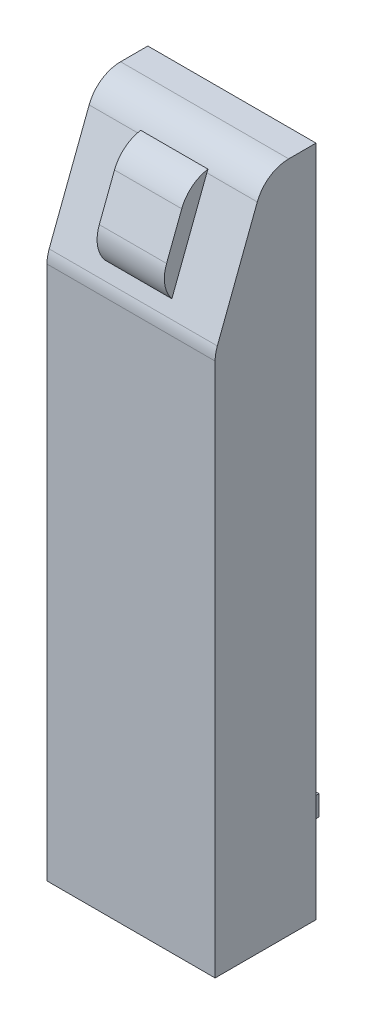
from build123d import *

# Parameters (mm, degrees)
CROQUIS1_W              = 50
CROQUIS1_H              = 200
SALIENTE_EXTRUIR1_DEPTH = 30
CORTAR_EXTRUIR1_DEPTH   = 60
CROQUIS3_W              = 20
CROQUIS3_H              = 30
SALIENTE_EXTRUIR2_DEPTH = 5
REDONDEO1_R             = 10
REDONDEO2_R             = 10
CROQUIS5_W              = 6
CROQUIS5_H              = 6
CROQUIS5_R              = 8
CROQUIS5_R_2            = 4
SALIENTE_EXTRUIR3_DEPTH = 5


with BuildPart() as part:
    # Croquis1 → Saliente-Extruir1 (new body)
    with BuildSketch(Plane.XY):
        Rectangle(CROQUIS1_W, CROQUIS1_H)
    extrude(amount=SALIENTE_EXTRUIR1_DEPTH)

    # Croquis2 → Cortar-Extruir1 (cut)
    with BuildSketch(Plane.ZY.offset(25)):
        Polygon((15, 100), (30, 60.706463385), (30, 100), align=None)
    extrude(amount=-CORTAR_EXTRUIR1_DEPTH, mode=Mode.SUBTRACT)

    # Croquis3 → Saliente-Extruir2 (add)
    with BuildSketch(Plane(origin=(0, 17.716995079, 46.41089299), x_dir=(1, 0, 0), z_dir=(0, 0.356639588239418, 0.9342420479192843))):
        with Locations((0, 67.044976998)):
            Rectangle(CROQUIS3_W, CROQUIS3_H)
    extrude(amount=SALIENTE_EXTRUIR2_DEPTH)

    # Redondeo1
    # the kernel refuses this fillet: 10 mm, written as the material it takes off along each edge
    with BuildSketch(Plane(origin=(-29.60955221, 60.706463385, 30), x_dir=(0, -1, 0), z_dir=(1, 0, 0))) as redondeo1_piece_1:
        with BuildLine():
            CenterArc((REDONDEO1_R * 0.184382088386, REDONDEO1_R), REDONDEO1_R, 249.106035538, 20.893964462)
            Line((-REDONDEO1_R * 0.172257499853, REDONDEO1_R * 0.0657579520807), (0, 0))
            Line((0, 0), (REDONDEO1_R * 0.184382088386, 0))
        make_face()
    extrude(amount=59.219104419, mode=Mode.SUBTRACT)
    with BuildSketch(Plane(origin=(-42.216106179, 100, 15), x_dir=(0, -0.934242047919284, 0.3566395882394187), z_dir=(1, 0, 0))) as redondeo1_piece_2_section:
        with BuildLine():
            CenterArc((REDONDEO1_R * 0.688644247166, REDONDEO1_R), REDONDEO1_R, 200.893964462, 69.106035538)
            Line((-REDONDEO1_R * 0.245597800753, REDONDEO1_R * 0.643360411761), (0, 0))
            Line((0, 0), (REDONDEO1_R * 0.688644247166, 0))
        make_face()
    redondeo1_piece_2 = extrude(amount=84.432212358, mode=Mode.PRIVATE)
    redondeo1_piece_2 = split(redondeo1_piece_2, bisect_by=Plane(origin=(-10, 94.011560914, 17.386219939), z_dir=(-1, 0, 0)), keep=Keep.TOP, mode=Mode.PRIVATE)
    redondeo1_piece_2 = split(redondeo1_piece_2, bisect_by=Plane(origin=(-26.10805309, 94.400241221, 17.237844274), z_dir=(0, -0.9342420479192843, 0.35663958823941805)), keep=Keep.TOP, mode=Mode.PRIVATE)
    add(redondeo1_piece_2, mode=Mode.SUBTRACT)
    with BuildSketch(Plane(origin=(-42.216106179, 100, 15), x_dir=(0, -0.934242047919284, 0.3566395882394187), z_dir=(1, 0, 0))) as redondeo1_piece_3_section:
        with BuildLine():
            CenterArc((REDONDEO1_R * 0.688644247166, REDONDEO1_R), REDONDEO1_R, 200.893964462, 69.106035538)
            Line((-REDONDEO1_R * 0.245597800753, REDONDEO1_R * 0.643360411761), (0, 0))
            Line((0, 0), (REDONDEO1_R * 0.688644247166, 0))
        make_face()
    redondeo1_piece_3 = extrude(amount=84.432212358, mode=Mode.PRIVATE)
    redondeo1_piece_3 = split(redondeo1_piece_3, bisect_by=Plane(origin=(-10, 98.665500542, 13.974903393), z_dir=(-1, 0, 0)), keep=Keep.TOP, mode=Mode.PRIVATE)
    redondeo1_piece_3 = split(redondeo1_piece_3, bisect_by=Plane(origin=(-26.10805309, 93.855575449, 15.811054644), z_dir=(0, 0.9342420479192843, -0.35663958823941805)), keep=Keep.TOP, mode=Mode.PRIVATE)
    add(redondeo1_piece_3, mode=Mode.SUBTRACT)
    with BuildSketch(Plane(origin=(-42.216106179, 100, 15), x_dir=(0, -0.934242047919284, 0.3566395882394187), z_dir=(1, 0, 0))) as redondeo1_piece_4_section:
        with BuildLine():
            CenterArc((REDONDEO1_R * 0.688644247166, REDONDEO1_R), REDONDEO1_R, 200.893964462, 69.106035538)
            Line((-REDONDEO1_R * 0.245597800753, REDONDEO1_R * 0.643360411761), (0, 0))
            Line((0, 0), (REDONDEO1_R * 0.688644247166, 0))
        make_face()
    redondeo1_piece_4 = extrude(amount=84.432212358, mode=Mode.PRIVATE)
    redondeo1_piece_4 = split(redondeo1_piece_4, bisect_by=Plane(origin=(-10, 98.665500542, 13.974903393), z_dir=(1, 0, 0)), keep=Keep.TOP, mode=Mode.PRIVATE)
    redondeo1_piece_4 = split(redondeo1_piece_4, bisect_by=Plane(origin=(0, 93.855575449, 15.811054644), z_dir=(0, 0.9342420479192843, -0.35663958823941805)), keep=Keep.TOP, mode=Mode.PRIVATE)
    redondeo1_piece_4 = split(redondeo1_piece_4, bisect_by=Plane(origin=(10, 98.665500542, 13.974903393), z_dir=(-1, 0, 0)), keep=Keep.TOP, mode=Mode.PRIVATE)
    add(redondeo1_piece_4, mode=Mode.SUBTRACT)
    with BuildSketch(Plane(origin=(-42.216106179, 100, 15), x_dir=(0, -0.934242047919284, 0.3566395882394187), z_dir=(1, 0, 0))) as redondeo1_piece_5_section:
        with BuildLine():
            CenterArc((REDONDEO1_R * 0.688644247166, REDONDEO1_R), REDONDEO1_R, 200.893964462, 69.106035538)
            Line((-REDONDEO1_R * 0.245597800753, REDONDEO1_R * 0.643360411761), (0, 0))
            Line((0, 0), (REDONDEO1_R * 0.688644247166, 0))
        make_face()
    redondeo1_piece_5 = extrude(amount=84.432212358, mode=Mode.PRIVATE)
    redondeo1_piece_5 = split(redondeo1_piece_5, bisect_by=Plane(origin=(26.10805309, 94.400241221, 17.237844274), z_dir=(0, -0.9342420479192843, 0.35663958823941805)), keep=Keep.TOP, mode=Mode.PRIVATE)
    redondeo1_piece_5 = split(redondeo1_piece_5, bisect_by=Plane(origin=(10, 94.011560914, 17.386219939), z_dir=(1, 0, 0)), keep=Keep.TOP, mode=Mode.PRIVATE)
    add(redondeo1_piece_5, mode=Mode.SUBTRACT)
    with BuildSketch(Plane(origin=(-42.216106179, 100, 15), x_dir=(0, -0.934242047919284, 0.3566395882394187), z_dir=(1, 0, 0))) as redondeo1_piece_6_section:
        with BuildLine():
            CenterArc((REDONDEO1_R * 0.688644247166, REDONDEO1_R), REDONDEO1_R, 200.893964462, 69.106035538)
            Line((-REDONDEO1_R * 0.245597800753, REDONDEO1_R * 0.643360411761), (0, 0))
            Line((0, 0), (REDONDEO1_R * 0.688644247166, 0))
        make_face()
    redondeo1_piece_6 = extrude(amount=84.432212358, mode=Mode.PRIVATE)
    redondeo1_piece_6 = split(redondeo1_piece_6, bisect_by=Plane(origin=(26.10805309, 93.855575449, 15.811054644), z_dir=(0, 0.9342420479192843, -0.35663958823941805)), keep=Keep.TOP, mode=Mode.PRIVATE)
    redondeo1_piece_6 = split(redondeo1_piece_6, bisect_by=Plane(origin=(10, 98.665500542, 13.974903393), z_dir=(1, 0, 0)), keep=Keep.TOP, mode=Mode.PRIVATE)
    add(redondeo1_piece_6, mode=Mode.SUBTRACT)

    # Redondeo2
    # the kernel refuses this fillet: 10 mm, written as the material it takes off along each edge
    with BuildSketch(Plane(origin=(31.650635095, 68.122798915, 32.520804063), x_dir=(0, 0.9342420479192848, -0.3566395882394171), z_dir=(-1, 0, 0))) as redondeo2_piece_1:
        with BuildLine():
            CenterArc((8.660254038, 10), REDONDEO2_R, 210, 60)
            Line((0, 5), (-0.173205081, 4.9))
            ThreePointArc((-0.173205081, 4.9), (-0.2, 2.5), (-0.2, 0))
            Line((-0.2, 0), (0, -0.2))
            Line((0, -0.2), (8.660254038, -0.2))
            Line((8.660254038, -0.2), (8.660254038, 0))
        make_face()
    extrude(amount=63.301270189, mode=Mode.SUBTRACT)
    with BuildSketch(Plane(origin=(-31.703453679, 96.150060353, 21.821616416), x_dir=(0, -0.3566395882395135, -0.9342420479192478), z_dir=(1, 0, 0))) as redondeo2_piece_2:
        with BuildLine():
            CenterArc((10, -8.681381471), REDONDEO2_R, 119.757004223, 60.242995777)
            Line((0, -8.681381471), (-0.2, -8.681381471))
            Line((-0.2, -8.681381471), (-0.2, 0))
            Line((-0.2, 0), (0, 0.2))
            ThreePointArc((0, 0.2), (2.518386828, 0.2), (4.937509129, 0.173627629))
            Line((4.937509129, 0.173627629), (5.036773655, 0))
        make_face()
    extrude(amount=63.406907357, mode=Mode.SUBTRACT)

    # Croquis5 → Saliente-Extruir3 (add)
    with BuildSketch(Plane(origin=(0, 0, 0), x_dir=(-1, 0, 0), z_dir=(0, 0, -1))):
        Polygon((-2.5, 80), (-2.5, 72.5), (-10, 72.5), (-10, 67.5), (-2.5, 67.5), (-2.5, 60), (2.5, 60), (2.5, 67.5), (10, 67.5), (10, 72.5), (2.5, 72.5), (2.5, 80), align=None)
        with Locations((-17.908573371, -75.072215566)):
            Rectangle(CROQUIS5_W, CROQUIS5_H)
        with Locations((18.091426629, -75.072215566)):
            Rectangle(CROQUIS5_W, CROQUIS5_H)
        with Locations((-5.908573371, -75.072215566)):
            Rectangle(CROQUIS5_W, CROQUIS5_H)
        with Locations((6.091426629, -75.072215566)):
            Rectangle(CROQUIS5_W, CROQUIS5_H)
        with Locations(Location((0, 26, 0), (0, 0, 180))):
            Circle(CROQUIS5_R)
        with Locations(Location((0, 0, 0), (0, 0, 180))):
            Circle(CROQUIS5_R_2)
        with Locations(Location((-12.5, 0, 0), (0, 0, 180))):
            Circle(CROQUIS5_R_2)
        with Locations(Location((12.5, 0, 0), (0, 0, 180))):
            Circle(CROQUIS5_R_2)
        with Locations(Location((0, -50, 0), (0, 0, 180))):
            Circle(CROQUIS5_R_2)
        with Locations(Location((0, -62.5, 0), (0, 0, 180))):
            Circle(CROQUIS5_R_2)
    extrude(amount=SALIENTE_EXTRUIR3_DEPTH)


solid = part.part
